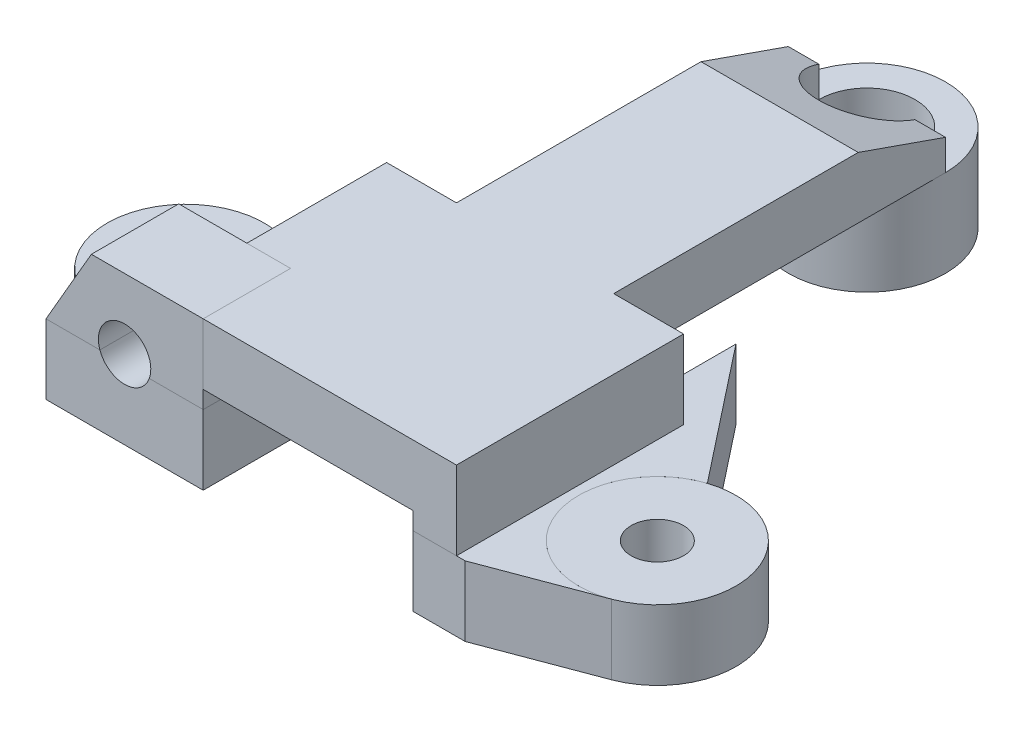
from build123d import *

# Parameters (mm, degrees)
SKETCH_1_R               = 4.5
SKETCH_1_R_2             = 1.5
EXTRUDE_2_DEPTH          = 4
EXTRUDE_2_2_DEPTH        = 4
EXTRUDE_2_3_DEPTH        = 4
EXTRUDE_3_DEPTH          = 4
EXTRUDE_START            = -5
EXTRUDE_4_DEPTH          = 5
CUT_EXTRUDE_1_DEPTH      = 7
EXTRUDE_5_DEPTH          = 4
SKETCH_6_R               = 4.5
SKETCH_6_R_2             = 1.5
EXTRUDE_6_DEPTH          = 1
SKETCH_7_W               = 2.5
SKETCH_7_H               = 8
SKETCH_7_H_2             = 5
SKETCH_7_W_2             = 6
EXTRUDE_7_DEPTH          = 4.5
EXTRUDE_8_DEPTH          = 3.5
CUT_EXTRUDE_2_DEPTH      = 41.031237802
CUT_EXTRUDE_2_DEPTH_BACK = 41.031237802
CUT_EXTRUDE_START        = 5
SKETCH_10_R              = 2.75
CUT_EXTRUDE_3_DEPTH      = 7
SKETCH_11_W              = 12
SKETCH_11_H              = 1
CUT_EXTRUDE_4_DEPTH      = 13


# Read off the part's stored shape, not the designer's step: Бобышка-Вытянуть4
with BuildPart() as part:
    # Эскиз1 → Бобышка-Вытянуть2 (new body)
    with BuildSketch(Plane(origin=(0, 0, 0), x_dir=(1, 0, 0), z_dir=(0, 1, 0))):
        with Locations(Location((0, 0, 0), (0, 0, 270))):
            Circle(SKETCH_1_R)
        with Locations(Location((0, 0, 0), (0, 0, 270))):
            Circle(SKETCH_1_R_2, mode=Mode.SUBTRACT)
    extrude(amount=EXTRUDE_2_DEPTH)

    # Эскиз6 → Бобышка-Вытянуть6 (add)
    with BuildSketch(Plane(origin=(0, 4, 0), x_dir=(1, 0, 0), z_dir=(0, 1, 0))):
        with Locations(Location((0, 0, 0), (0, 0, 270))):
            Circle(SKETCH_6_R)
        with Locations(Location((0, 0, 0), (0, 0, 270))):
            Circle(SKETCH_6_R_2, mode=Mode.SUBTRACT)
    extrude(amount=EXTRUDE_6_DEPTH)



with BuildPart() as body_2:
    # Эскиз1 → Extrude 2 2 (new body)
    with BuildSketch(Plane(origin=(0, 0, 0), x_dir=(1, 0, 0), z_dir=(0, 1, 0))):
        with Locations(Location((13.5, -25.5, 0), (0, 0, 270))):
            Circle(SKETCH_1_R)
        with Locations(Location((13.5, -25.5, 0), (0, 0, 270))):
            Circle(SKETCH_1_R_2, mode=Mode.SUBTRACT)
    extrude(amount=EXTRUDE_2_2_DEPTH)


with BuildPart() as body_3:
    # Эскиз1 → Extrude 2 3 (new body)
    with BuildSketch(Plane(origin=(0, 0, 0), x_dir=(1, 0, 0), z_dir=(0, 1, 0))):
        with Locations(Location((-13.5, -25.5, 0), (0, 0, 270))):
            Circle(SKETCH_1_R)
        with Locations(Location((-13.5, -25.5, 0), (0, 0, 270))):
            Circle(SKETCH_1_R_2, mode=Mode.SUBTRACT)
    extrude(amount=EXTRUDE_2_3_DEPTH)

    # Эскиз2 → Бобышка-Вытянуть3 (add)
    with BuildSketch(Plane(origin=(0, 0, 0), x_dir=(1, 0, 0), z_dir=(0, 1, 0))):
        with BuildLine():
            Line((-15, -29.742640687), (-15, -32))
            Line((-15, -32), (-6, -32))
            Line((-6, -32), (-6, -13.5))
            Line((-6, -13.5), (-12.090241258, -21.22652597))
            ThreePointArc((-12.090241258, -21.22652597), (-9.241703587, -26.95496105), (-15, -29.742640687))
        make_face()
    extrude(amount=EXTRUDE_3_DEPTH)


with BuildPart() as body_4:
    # Бобышка-Вытянуть4 outline → Бобышка-Вытянуть4 (new body)
    with BuildSketch(Plane.XY.offset(32).offset(EXTRUDE_START)):
        Polygon((-12.401923789, 8.5), (-15, 4), (-6, 4), (-6, 8.5), align=None)
    extrude(amount=EXTRUDE_4_DEPTH)


with BuildPart() as cut_extrude_1_tool:
    # Эскиз4 → Вырез-Вытянуть1 (new body)
    with BuildSketch(Plane.XY.offset(32)):
        with BuildLine():
            ThreePointArc((-9.085786438, 4), (-9.021602161, 4.246347032), (-9, 4.5))
            ThreePointArc((-9, 4.5), (-10.753652968, 5.978397839), (-11.914213562, 4))
            Line((-11.914213562, 4), (-9.085786438, 4))
        make_face()
        with BuildLine():
            Line((-9.085786438, 4), (-11.914213562, 4))
            ThreePointArc((-11.914213562, 4), (-10.5, 3), (-9.085786438, 4))
        make_face()
    extrude(amount=-CUT_EXTRUDE_1_DEPTH)


with BuildPart() as body_3_1:
    add(body_3.part)

    # Вырез-Вытянуть1: cut by cut_extrude_1_tool
    add(cut_extrude_1_tool.part, mode=Mode.SUBTRACT)


with BuildPart() as body_4_1:
    add(body_4.part)

    # Вырез-Вытянуть1: cut by cut_extrude_1_tool
    add(cut_extrude_1_tool.part, mode=Mode.SUBTRACT)


with BuildPart() as body_5:
    # Эскиз5 → Бобышка-Вытянуть5 (new body)
    with BuildSketch(Plane(origin=(0, 0, 0), x_dir=(1, 0, 0), z_dir=(0, 1, 0))):
        with BuildLine():
            Line((6, -32), (9, -32))
            Line((9, -32), (15.084, -29.712))
            ThreePointArc((15.084, -29.712), (9.256368609, -26.997194916), (12.090241258, -21.22652597))
            Line((12.090241258, -21.22652597), (6, -13.5))
            Line((6, -13.5), (6, -17.357142857))
            Line((6, -17.357142857), (6, -32))
        make_face()
    extrude(amount=EXTRUDE_5_DEPTH)


with BuildPart() as body_6:
    # Эскиз7 → Бобышка-Вытянуть7 (new body)
    with BuildSketch(Plane(origin=(0, 4, 0), x_dir=(1, 0, 0), z_dir=(0, 1, 0))):
        with Locations((7.25, -23)):
            Rectangle(SKETCH_7_W, SKETCH_7_H)
        with Locations((7.25, -29.5)):
            Rectangle(SKETCH_7_W, SKETCH_7_H_2)
        with Locations((3, -23)):
            Rectangle(SKETCH_7_W_2, SKETCH_7_H)
        with Locations((3, -29.5)):
            Rectangle(SKETCH_7_W_2, SKETCH_7_H_2)
        Polygon((0, -27), (0, -19), (-8.5, -19), (-8.5, -27), (-6, -27), align=None)
        with Locations((-3, -29.5)):
            Rectangle(SKETCH_7_W_2, SKETCH_7_H_2)
    extrude(amount=EXTRUDE_7_DEPTH)


with BuildPart() as part_1:
    add(part.part)

    add(body_6.part)  # Бобышка-Вытянуть8 merges body 6
    # Эскиз8 → Бобышка-Вытянуть8 (add)
    with BuildSketch(Plane(origin=(0, 5, 0), x_dir=(1, 0, 0), z_dir=(0, 1, 0))):
        with BuildLine():
            Line((4.5, 0), (4.5, -19))
            Line((4.5, -19), (-4.5, -19))
            Line((-4.5, -19), (-4.5, 0))
            Line((-4.5, 0), (-1.5, 0))
            ThreePointArc((-1.5, 0), (0, -1.5), (1.5, 0))
            Line((1.5, 0), (4.5, 0))
        make_face()
    extrude(amount=EXTRUDE_8_DEPTH)

    # Эскиз9 → Вырез-Вытянуть2 (cut, two sides: drawn at the far end of the back side and taken through both)
    with BuildSketch(Plane.ZY.offset(4.5).offset(-CUT_EXTRUDE_2_DEPTH_BACK)):
        Polygon((0, 8.5), (0, 6.75), (5, 8.5), align=None)
    extrude(amount=CUT_EXTRUDE_2_DEPTH + CUT_EXTRUDE_2_DEPTH_BACK, mode=Mode.SUBTRACT)

    # Эскиз10 → Вырез-Вытянуть3 (cut)
    with BuildSketch(Plane(origin=(0, 5, 0), x_dir=(1, 0, 0), z_dir=(0, 1, 0)).offset(CUT_EXTRUDE_START)):
        with Locations(Location((0, 0, 0), (0, 0, 270))):
            Circle(SKETCH_10_R)
    extrude(amount=-CUT_EXTRUDE_3_DEPTH, mode=Mode.SUBTRACT)

    # Эскиз11 → Вырез-Вытянуть4 (cut)
    with BuildSketch(Plane.XY.offset(32)):
        with Locations((0, 4.5)):
            Rectangle(SKETCH_11_W, SKETCH_11_H)
    extrude(amount=-CUT_EXTRUDE_4_DEPTH, mode=Mode.SUBTRACT)


solid = Compound([body_2.part, body_3_1.part, body_4_1.part, body_5.part, part_1.part])
